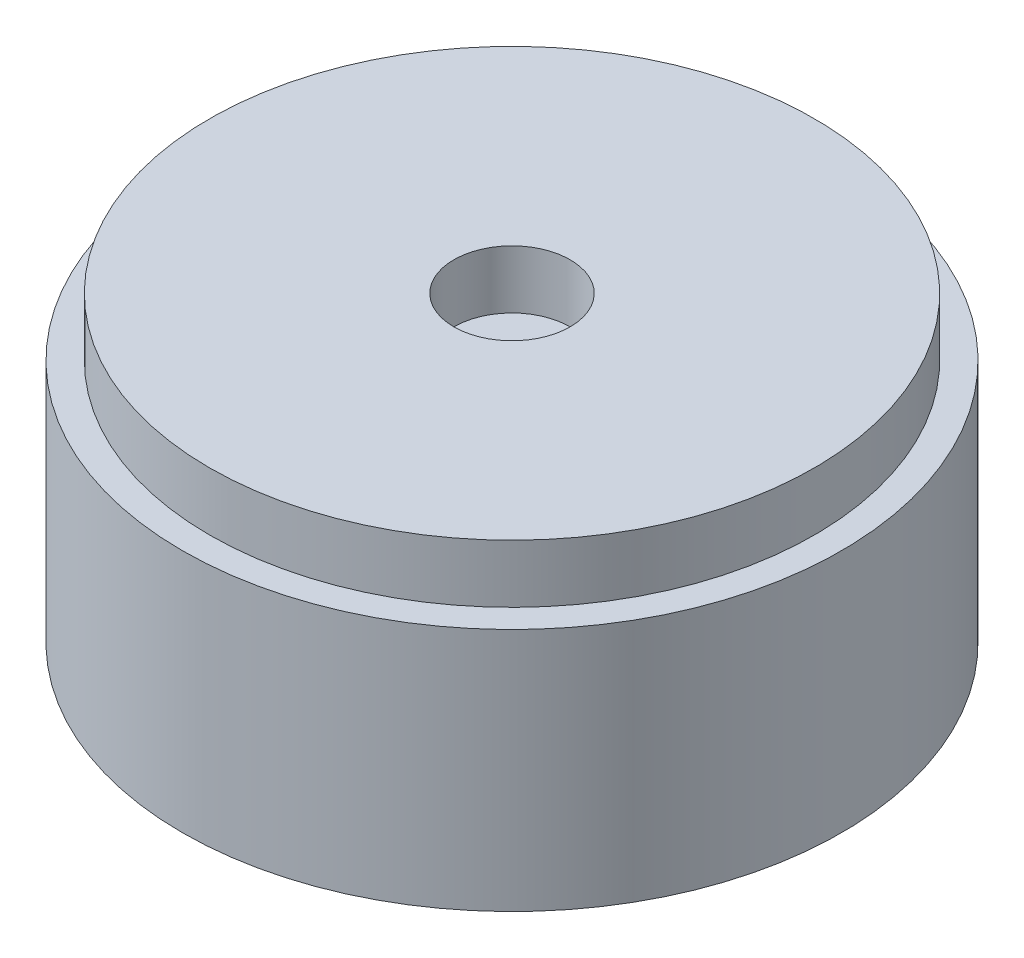
from build123d import *
from OCP.BRepFilletAPI import BRepFilletAPI_MakeChamfer

# Parameters (mm, degrees)
SKETCH1_R           = 8.5
BOSS_EXTRUDE1_DEPTH = 7.8
CUT_EXTRUDE1_START  = -1.5
SKETCH2_R           = 8.5
SKETCH2_R_2         = 7.8
SKETCH2_R_3         = 1.5
CUT_EXTRUDE1_DEPTH  = 1.5
SKETCH3_R           = 0.5
BOSS_EXTRUDE2_DEPTH = 2
CHAMFER1_SIZE       = 0.5
CHAMFER1_SIZE2      = 0.1
FILLET1_R           = 1


with BuildPart() as part:
    # Sketch1 → Boss-Extrude1 (new body)
    with BuildSketch(Plane(origin=(0, 0, 0), x_dir=(1, 0, 0), z_dir=(0, 1, 0))):
        Circle(SKETCH1_R)
    extrude(amount=BOSS_EXTRUDE1_DEPTH)

    # Sketch2 → Cut-Extrude1 (cut)
    # profile 1 of 2: a face of its own
    with BuildSketch(Plane(origin=(0, 7.8, 0), x_dir=(1, 0, 0), z_dir=(0, 1, 0)).offset(CUT_EXTRUDE1_START)):
        Circle(SKETCH2_R)
        Circle(SKETCH2_R_2, mode=Mode.SUBTRACT)
    # profile 2 of 2: a face of its own
    with BuildSketch(Plane(origin=(0, 7.8, 0), x_dir=(1, 0, 0), z_dir=(0, 1, 0)).offset(CUT_EXTRUDE1_START)):
        Circle(SKETCH2_R_3)
    extrude(amount=CUT_EXTRUDE1_DEPTH, mode=Mode.SUBTRACT)

    # Sketch3 → Boss-Extrude2 (add)
    with BuildSketch(Plane.XZ):
        with Locations((-5, 5)):
            Circle(SKETCH3_R)
        with Locations((5, -5)):
            Circle(SKETCH3_R)
    extrude(amount=BOSS_EXTRUDE2_DEPTH)

    # Chamfer1: one chamfer whose edges measure the first distance from different faces: ONE call of the kernel's chamfer builder (chamfer() names one face for all edges)
    chamfer1_edges_1 = [part.edges().sort_by_distance(p)[0] for p in [
        (-5.5, -2, 5),
    ]]
    chamfer1_side_1 = [part.faces().sort_by_distance(p)[0] for p in [
        (-5.5, -1, 5),
    ]]
    chamfer1_edges_2 = [part.edges().sort_by_distance(p)[0] for p in [
        (4.5, -2, -5),
    ]]
    chamfer1_side_2 = [part.faces().sort_by_distance(p)[0] for p in [
        (4.5, -1, -5),
    ]]
    chamfer1 = BRepFilletAPI_MakeChamfer(part.part.solid().wrapped)
    for e in chamfer1_edges_1:
        chamfer1.Add(CHAMFER1_SIZE, CHAMFER1_SIZE2, e.wrapped, chamfer1_side_1[0].wrapped)  # the first distance lies on this face
    for e in chamfer1_edges_2:
        chamfer1.Add(CHAMFER1_SIZE, CHAMFER1_SIZE2, e.wrapped, chamfer1_side_2[0].wrapped)  # the first distance lies on this face
    add(Compound.cast(chamfer1.Shape()), mode=Mode.REPLACE)

    # Fillet1
    fillet1_edges = [part.edges().sort_by_distance(p)[0] for p in [
        (-5.5, -1.5, 5),
        (4.5, -1.5, -5),
    ]]
    fillet(fillet1_edges, radius=FILLET1_R)


solid = part.part
